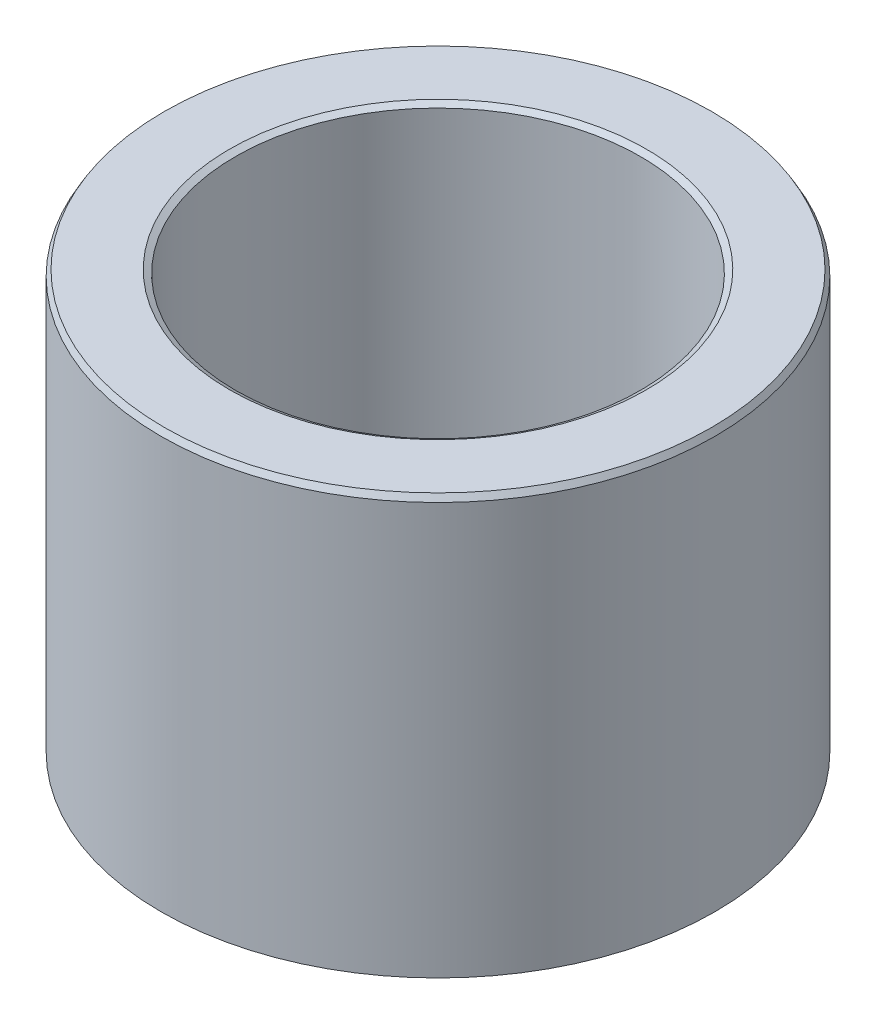
from build123d import *
from OCP.BRepFilletAPI import BRepFilletAPI_MakeChamfer

# Parameters (mm, degrees)
SKETCH1_R           = 42.5
BOSS_EXTRUDE1_DEPTH = 64.588025317
SKETCH2_R           = 31.06358084
CUT_EXTRUDE1_DEPTH  = 89.227620473
CHAMFER1_SIZE       = 0.909263634
CHAMFER1_SIZE2      = 0.524963604


with BuildPart() as part:
    # Sketch1 → Boss-Extrude1 (new body)
    with BuildSketch(Plane(origin=(0, 0, 0), x_dir=(1, 0, 0), z_dir=(0, 1, 0))):
        Circle(SKETCH1_R)
    extrude(amount=BOSS_EXTRUDE1_DEPTH)

    # Sketch2 → Cut-Extrude1 (cut, through all)
    with BuildSketch(Plane(origin=(0, 0, 0), x_dir=(1, 0, 0), z_dir=(0, 1, 0))):
        Circle(SKETCH2_R)
    extrude(amount=CUT_EXTRUDE1_DEPTH, mode=Mode.SUBTRACT)

    # Chamfer1: one chamfer whose edges measure the first distance from different faces: ONE call of the kernel's chamfer builder (chamfer() names one face for all edges)
    chamfer1_edges_1 = [part.edges().sort_by_distance(p)[0] for p in [
        (-31.06358084, 64.588025317, 0),
    ]]
    chamfer1_side_1 = [part.faces().sort_by_distance(p)[0] for p in [
        (-41.297918472, 64.588025317, 0),
    ]]
    chamfer1_edges_2 = [part.edges().sort_by_distance(p)[0] for p in [
        (-31.06358084, 0, 0),
    ]]
    chamfer1_side_2 = [part.faces().sort_by_distance(p)[0] for p in [
        (-31.06358084, 32.294012658, 0),
    ]]
    chamfer1_edges_3 = [part.edges().sort_by_distance(p)[0] for p in [
        (-42.5, 0, 0),
    ]]
    chamfer1_side_3 = [part.faces().sort_by_distance(p)[0] for p in [
        (-41.297918472, 0, 0),
    ]]
    chamfer1_edges_4 = [part.edges().sort_by_distance(p)[0] for p in [
        (-42.5, 64.588025317, 0),
    ]]
    chamfer1_side_4 = [part.faces().sort_by_distance(p)[0] for p in [
        (-42.5, 32.294012658, 0),
    ]]
    chamfer1 = BRepFilletAPI_MakeChamfer(part.part.solid().wrapped)
    for e in chamfer1_edges_1:
        chamfer1.Add(CHAMFER1_SIZE, CHAMFER1_SIZE2, e.wrapped, chamfer1_side_1[0].wrapped)  # the first distance lies on this face
    for e in chamfer1_edges_2:
        chamfer1.Add(CHAMFER1_SIZE, CHAMFER1_SIZE2, e.wrapped, chamfer1_side_2[0].wrapped)  # the first distance lies on this face
    for e in chamfer1_edges_3:
        chamfer1.Add(CHAMFER1_SIZE, CHAMFER1_SIZE2, e.wrapped, chamfer1_side_3[0].wrapped)  # the first distance lies on this face
    for e in chamfer1_edges_4:
        chamfer1.Add(CHAMFER1_SIZE, CHAMFER1_SIZE2, e.wrapped, chamfer1_side_4[0].wrapped)  # the first distance lies on this face
    add(Compound.cast(chamfer1.Shape()), mode=Mode.REPLACE)


solid = part.part
